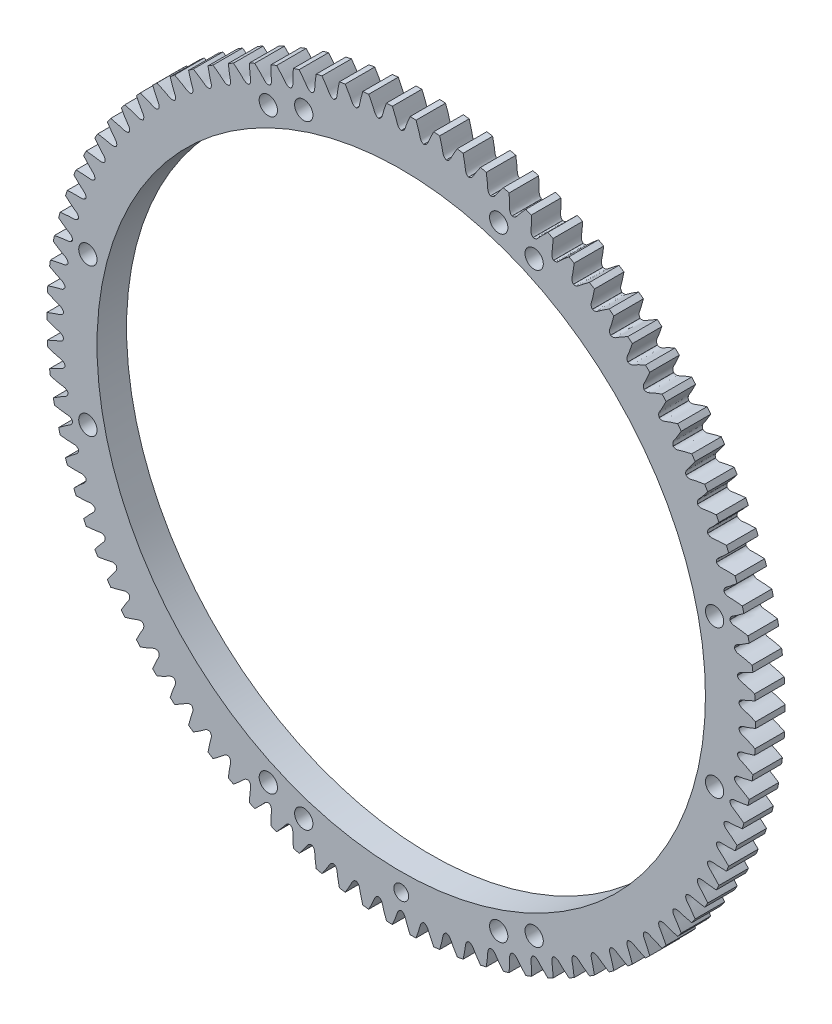
from build123d import *

# Parameters (mm, degrees)
SKETCH_1_R               = 60
EXTRUDE_1_DEPTH          = 5
CUT_EXTRUDE_1_DEPTH      = 5
PATTERN_CIRCULAR_1_COUNT = 94
SKETCH_4_R               = 51.5
SKETCH_4_R_2             = 1.55
CUT_EXTRUDE_2_DEPTH      = 5
SKETCH_5_R               = 1.25
CUT_EXTRUDE_3_DEPTH      = 5


with BuildPart() as part:
    # 草图1 → 凸台-拉伸1 (new body)
    with BuildSketch(Plane.XY):
        Circle(SKETCH_1_R)
    extrude(amount=EXTRUDE_1_DEPTH)

    # 草图2 → 切除-拉伸1 (cut)
    with BuildSketch(Plane.XY):
        with BuildLine():
            ThreePointArc((0.01, 57.186317579), (0, 57.186318453), (-0.01, 57.186317579))
            add(Edge.make_bspline(
                [(-0.01, 57.186317579), (-0.547529763, 57.345772295), (-0.668487224, 57.900163897), (-0.90645965, 58.543463587), (-1.04857383, 58.918300958), (-1.207595584, 59.309984426), (-1.382779599, 59.718914405), (-1.575302684, 60.144321976), (-1.785767079, 60.585747398), (-2.014922122, 61.042612733), (-2.263455421, 61.514345531), (-2.532052088, 62.000343791), (-2.82137701, 62.499986514), (-3.132079175, 63.012631222), (-3.464789711, 63.537615222), (-3.820121724, 64.074255814), (-4.198669646, 64.621850823), (-4.601008725, 65.179679058), (-5.027694546, 65.747000799), (-5.479262299, 66.323058309), (-6.124528227, 67.113151973), (-6.63359908, 67.699155134), (-6.985364198, 68.08853868)],
                knots=[0, 0, 0, 0, 0.098236624, 0.127248611, 0.157952829, 0.190349276, 0.224437952, 0.260218858, 0.297691994, 0.336857359, 0.377714954, 0.420264778, 0.464506832, 0.510441116, 0.558067629, 0.607386372, 0.658397344, 0.711100546, 0.765495978, 0.821583639, 0.87936353, 1, 1, 1, 1], degree=3))
            ThreePointArc((-6.985364198, 68.08853868), (0, 68.445923272), (6.985364198, 68.08853868))
            add(Edge.make_bspline(
                [(0.01, 57.186317579), (0.547529763, 57.345772295), (0.668487224, 57.900163897), (0.90645965, 58.543463587), (1.04857383, 58.918300958), (1.207595584, 59.309984426), (1.382779599, 59.718914405), (1.575302684, 60.144321976), (1.785767079, 60.585747398), (2.014922122, 61.042612733), (2.263455421, 61.514345531), (2.532052088, 62.000343791), (2.82137701, 62.499986514), (3.132079175, 63.012631222), (3.464789711, 63.537615222), (3.820121724, 64.074255814), (4.198669646, 64.621850823), (4.601008725, 65.179679058), (5.027694546, 65.747000799), (5.479262299, 66.323058309), (6.124528227, 67.113151973), (6.63359908, 67.699155134), (6.985364198, 68.08853868)],
                knots=[0, 0, 0, 0, 0.098236624, 0.127248611, 0.157952829, 0.190349276, 0.224437952, 0.260218858, 0.297691994, 0.336857359, 0.377714954, 0.420264778, 0.464506832, 0.510441116, 0.558067629, 0.607386372, 0.658397344, 0.711100546, 0.765495978, 0.821583639, 0.87936353, 1, 1, 1, 1], degree=3))
        make_face()
    cut_extrude_1 = extrude(amount=CUT_EXTRUDE_1_DEPTH, mode=Mode.SUBTRACT)

    # 阵列(圆周)1: 切除-拉伸1 ×94 about axis
    pattern_circular_1_axis = Axis((0, 0, -66), (0, 0, 1))
    for i in range(1, PATTERN_CIRCULAR_1_COUNT):
        add(cut_extrude_1.rotate(pattern_circular_1_axis, i * 360 / PATTERN_CIRCULAR_1_COUNT), mode=Mode.SUBTRACT)

    # 草图4 → 切除-拉伸2 (cut)
    with BuildSketch(Plane.XY.offset(5)):
        Circle(SKETCH_4_R)
        with Locations((16.5, 51.942275653)):
            Circle(SKETCH_4_R_2)
        with Locations((22.5, 49.638694584)):
            Circle(SKETCH_4_R_2)
        with Locations((53.047148839, 12.5)):
            Circle(SKETCH_4_R_2)
        with Locations((22.5, -49.638694584)):
            Circle(SKETCH_4_R_2)
        with Locations((16.5, -51.942275653)):
            Circle(SKETCH_4_R_2)
        with Locations((53.047148839, -12.5)):
            Circle(SKETCH_4_R_2)
        with Locations((-16.5, -51.942275653)):
            Circle(SKETCH_4_R_2)
        with Locations((-22.5, -49.638694584)):
            Circle(SKETCH_4_R_2)
        with Locations((-53.047148839, -12.5)):
            Circle(SKETCH_4_R_2)
        with Locations((-53.047148839, 12.5)):
            Circle(SKETCH_4_R_2)
        with Locations((-22.5, 49.638694584)):
            Circle(SKETCH_4_R_2)
        with Locations((-16.5, 51.942275653)):
            Circle(SKETCH_4_R_2)
    extrude(amount=-CUT_EXTRUDE_2_DEPTH, mode=Mode.SUBTRACT)

    # 草图5 → 切除-拉伸3 (cut)
    with BuildSketch(Plane.XY.offset(5)):
        with Locations((0, -54.5)):
            Circle(SKETCH_5_R)
    extrude(amount=-CUT_EXTRUDE_3_DEPTH, mode=Mode.SUBTRACT)


solid = part.part
